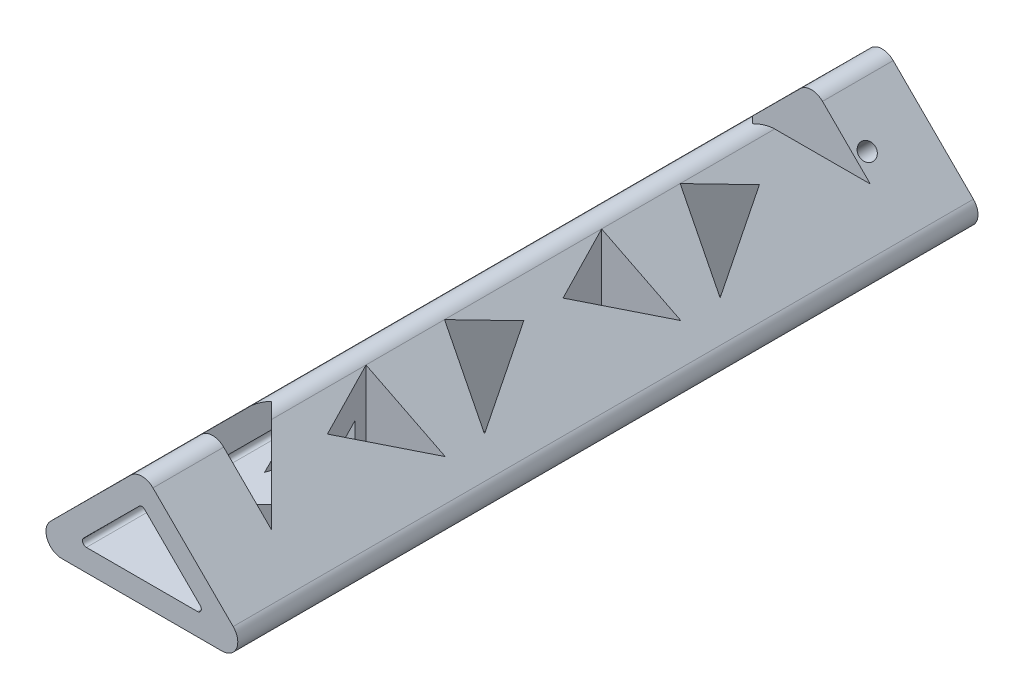
from build123d import *

# Parameters (mm, degrees)
EXTRUDE_1_DEPTH     = 94.25
FILLET_1_R          = 4
CUT_EXTRUDE_1_DEPTH = 102.407759515
CUT_EXTRUDE_2_DEPTH = 50
FILLET_2_R          = 1
CUT_EXTRUDE_3_REACH = 105.265
SKETCH_4_R          = 2.099998968
MIRROR_START        = -21.249891576
MIRROR_1_OUTLINE_R  = 2.099998968
MIRROR_1_DEPTH      = 15.877614812


# Read off the part's stored shape, not the designer's step: 镜向1
with BuildPart() as part:
    # 草图1 → 凸台-拉伸1 (new, symmetric)
    with BuildSketch(Plane.XY):
        Polygon((-30.1, 0), (30.1, 0), (0, 30.003999733), align=None)
    extrude(amount=EXTRUDE_1_DEPTH, both=True)

    # 圆角1
    fillet_1_edges = [part.edges().sort_by_distance(p)[0] for p in [
        (0, 30.003999733, 0),
        (30.1, 0, 0),
        (-30.1, 0, 0),
    ]]
    fillet(fillet_1_edges, radius=FILLET_1_R)

    # 草图3 → 切除-拉伸1 (cut, through all)
    with BuildSketch(Plane(origin=(0, 0, 0), x_dir=(1, 0, 0), z_dir=(0, 1, 0))):
        Polygon((-15, 76.25), (0, 61.25), (15, 76.25), align=None)
        Polygon((-8, 55), (-18, 35), (-2.823905857, 40), align=None)
        Polygon((2.823905857, 40), (8, 55), (18, 35), align=None)
        Polygon((8, 5), (18, 25), (2.823905857, 20), align=None)
        Polygon((-2.823905857, 20), (-8, 5), (-18, 25), align=None)
        Polygon((-8, -5), (-18, -25), (-2.823905857, -20), align=None)
        Polygon((2.823905857, -20), (8, -5), (18, -25), align=None)
        Polygon((8, -55), (18, -35), (2.823905857, -40), align=None)
        Polygon((-2.823905857, -40), (-8, -55), (-18, -35), align=None)
        Polygon((15, -76.25), (0, -61.25), (-15, -76.25), align=None)
    extrude(amount=CUT_EXTRUDE_1_DEPTH, mode=Mode.SUBTRACT)

    # 草图2 → 切除-拉伸2 (cut)
    with BuildSketch(Plane.XY.offset(94.25)):
        Polygon((16.549806572, 5.6), (0, 22.097022989), (-16.549806572, 5.6), align=None)
    extrude(amount=-CUT_EXTRUDE_2_DEPTH, mode=Mode.SUBTRACT)

    # 圆角2
    # the kernel refuses this fillet: 1 mm, written as the material it adds along each edge
    with BuildSketch(Plane(origin=(16.549806572, 5.6, 94.25), x_dir=(-0.708235294117647, 0.7059764643145621, 0), z_dir=(0, 0, -1))) as fillet_2_piece_1_section:
        with BuildLine():
            CenterArc((FILLET_2_R * 2.41967739785, -FILLET_2_R), FILLET_2_R, 90, 135.091514799)
            Line((FILLET_2_R * 1.71370093354, -FILLET_2_R * 1.70823529412), (0, 0))
            Line((0, 0), (FILLET_2_R * 2.41967739785, 0))
        make_face()
    fillet_2_piece_1 = extrude(amount=56.049193495, mode=Mode.PRIVATE)
    fillet_2_piece_1 = split(fillet_2_piece_1, bisect_by=Plane(origin=(15.464898835, 6.046572168, 76.25), z_dir=(0, 0, 1)), keep=Keep.TOP, mode=Mode.PRIVATE)
    add(fillet_2_piece_1)
    with BuildSketch(Plane(origin=(16.549806572, 5.6, 100.299193495), x_dir=(-0.708235294117647, 0.7059764643145621, 0), z_dir=(0, 0, -1))) as fillet_2_piece_2_section:
        with BuildLine():
            CenterArc((FILLET_2_R * 2.41967739785, -FILLET_2_R), FILLET_2_R, 90, 135.091514799)
            Line((FILLET_2_R * 1.71370093354, -FILLET_2_R * 1.70823529412), (0, 0))
            Line((0, 0), (FILLET_2_R * 2.41967739785, 0))
        make_face()
    fillet_2_piece_2 = extrude(amount=56.049193495, mode=Mode.PRIVATE)
    fillet_2_piece_2 = split(fillet_2_piece_2, bisect_by=Plane(origin=(7.231801864, 6.045019986, 68.481801864), z_dir=(0.7071067811865476, 0, -0.7071067811865476)), keep=Keep.TOP, mode=Mode.PRIVATE)
    add(fillet_2_piece_2)
    with BuildSketch(Plane(origin=(-16.549806572, 5.6, 94.25), x_dir=(0.7082352941176473, 0.7059764643145617, 0), z_dir=(0, 0, -1))) as fillet_2_piece_3_section:
        with BuildLine():
            CenterArc((FILLET_2_R * 2.41967739785, FILLET_2_R), FILLET_2_R, 134.908485201, 135.091514799)
            Line((FILLET_2_R * 1.71370093354, FILLET_2_R * 1.70823529412), (0, 0))
            Line((0, 0), (FILLET_2_R * 2.41967739785, 0))
        make_face()
    fillet_2_piece_3 = extrude(amount=56.049193495, mode=Mode.PRIVATE)
    fillet_2_piece_3 = split(fillet_2_piece_3, bisect_by=Plane(origin=(-15.464898835, 6.046572168, 76.25), z_dir=(0, 0, 1)), keep=Keep.TOP, mode=Mode.PRIVATE)
    add(fillet_2_piece_3)
    with BuildSketch(Plane(origin=(-16.549806572, 5.6, 100.299193495), x_dir=(0.7082352941176469, 0.7059764643145621, 0), z_dir=(0, 0, -1))) as fillet_2_piece_4_section:
        with BuildLine():
            CenterArc((FILLET_2_R * 2.41967739785, FILLET_2_R), FILLET_2_R, 134.908485201, 135.091514799)
            Line((FILLET_2_R * 1.71370093354, FILLET_2_R * 1.70823529412), (0, 0))
            Line((0, 0), (FILLET_2_R * 2.41967739785, 0))
        make_face()
    fillet_2_piece_4 = extrude(amount=56.049193495, mode=Mode.PRIVATE)
    fillet_2_piece_4 = split(fillet_2_piece_4, bisect_by=Plane(origin=(-7.231801864, 6.045019986, 68.481801864), z_dir=(-0.7071067811865476, 0, -0.7071067811865476)), keep=Keep.TOP, mode=Mode.PRIVATE)
    add(fillet_2_piece_4)
    with BuildSketch(Plane(origin=(0, 22.097022989, 94.25), x_dir=(0.7082352941176462, -0.7059764643145627, 0), z_dir=(0, 0, -1))) as fillet_2_piece_5:
        with BuildLine():
            CenterArc((FILLET_2_R * 0.996810622371, FILLET_2_R), FILLET_2_R, 180.183029597, 89.816970403)
            Line((-FILLET_2_R * 0.00318427531686, FILLET_2_R * 0.996805536332), (0, 0))
            Line((0, 0), (FILLET_2_R * 0.996810622371, 0))
        make_face()
    extrude(amount=18)

    # 切除-拉伸3: up to this plane
    cut_extrude_3_end = Plane(origin=(-30.1, 0, 94.25), z_dir=(0, 1, 0))
    # 草图4 → 切除-拉伸3 (cut, up to the surface)
    with BuildSketch(Plane(origin=(15.001923322, 15.04992321, 0), x_dir=(0.7082352941176471, -0.705976464314562, 0), z_dir=(0.705976464314562, 0.7082352941176471, 0)), mode=Mode.PRIVATE) as cut_extrude_3_sk1:
        with Locations(Location((-5.355142644, 79.25, 0), (0, 0, 180))):
            Circle(SKETCH_4_R)
    cut_extrude_3_tool1 = split(extrude(cut_extrude_3_sk1.sketch, amount=-CUT_EXTRUDE_3_REACH, mode=Mode.PRIVATE), bisect_by=cut_extrude_3_end, keep=Keep.BOTH, mode=Mode.PRIVATE)
    add(cut_extrude_3_tool1.solids().sort_by_distance((11.209222, 18.830528, -79.25))[0], mode=Mode.SUBTRACT)

    # 镜向1 outline → 镜向1 (cut)
    with BuildSketch(Plane(origin=(0, 0, 0), x_dir=(0.7082352941176469, 0.7059764643145621, 0), z_dir=(0.7059764643145621, -0.7082352941176471, 0)).offset(MIRROR_START)):
        with Locations((5.355142644, -79.25)):
            Circle(MIRROR_1_OUTLINE_R)
    extrude(amount=MIRROR_1_DEPTH, mode=Mode.SUBTRACT)


solid = part.part
